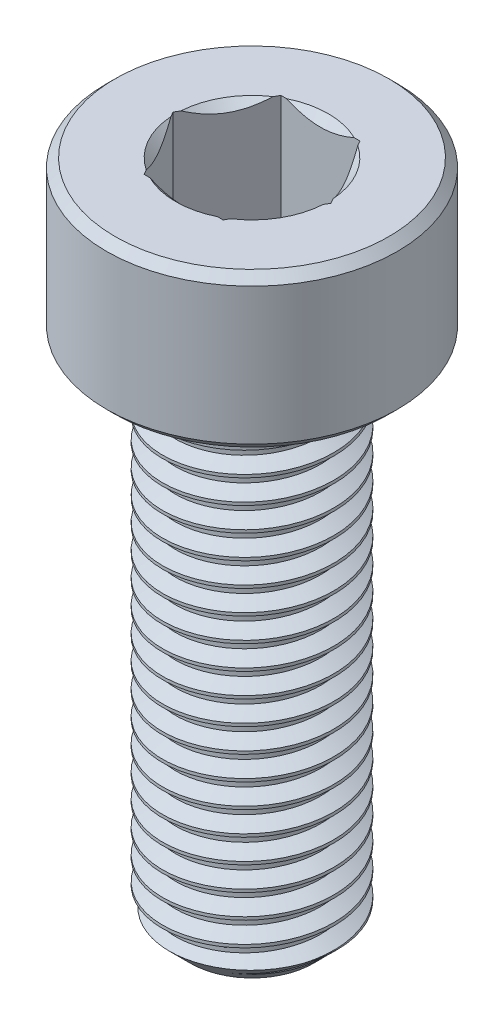
from build123d import *

# Parameters (mm, degrees)
SKETCH1_R           = 2.5
BOSS_EXTRUDE2_DEPTH = 15
CHAMFER1_SIZE       = 0.7
THREAD2_PITCH       = 0.7
SKETCH11_R          = 4.25
BOSS_EXTRUDE3_DEPTH = 4.5
SKETCH12_R          = 2
CUT_EXTRUDE4_DEPTH  = 3.5
CHAMFER3_SIZE       = 0.23
CHAMFER4_SIZE       = 0.25
CUT_EXTRUDE7_DEPTH  = 3.5


with BuildPart() as part:
    # Sketch1 → Boss-Extrude2 (new body)
    with BuildSketch(Plane(origin=(0, 0, 0), x_dir=(1, 0, 0), z_dir=(0, 1, 0))):
        with Locations(Location((0, 0, 0), (0, 0, 270))):
            Circle(SKETCH1_R)
    extrude(amount=BOSS_EXTRUDE2_DEPTH)

    # Chamfer1
    chamfer1_edges = [part.edges().sort_by_distance(p)[0] for p in [
        (0, 0, -2.5),
    ]]
    chamfer(chamfer1_edges, length=CHAMFER1_SIZE)

    # Thread2: the profile of Thread Profile4 profile screwed along a right-hand helix of 57.142857 turns, 6 arcs to a turn; built about Z, then put on its axis
    thread2_z = Axis((0, 0, 0), (0, 0, 1))
    thread2_corners = [(2.5003, 0, -0.000173205), (2.5003, 0, 0.612673203), (2.121113887, 0, 0.393749999), (2.121113887, 0, 0.218749999)]
    with BuildLine(mode=Mode.PRIVATE) as thread2_profile:
        Line(thread2_corners[0], thread2_corners[1])
        Line(thread2_corners[1], thread2_corners[2])
        Line(thread2_corners[2], thread2_corners[3])
        Line(thread2_corners[3], thread2_corners[0])
    thread2_cap = Face(thread2_profile.wire())
    thread2_turn_angles = [0, 30, 60, 90, 120, 150, 180, 210, 240, 270, 300, 330, 360, 390, 420, 450, 480, 510, 540, 570, 600, 630, 660, 690, 720]
    thread2_turn_weights = [1, 0.8660254037844387, 1, 0.8660254037844387, 1, 0.8660254037844387, 1, 0.8660254037844387, 1, 0.8660254037844387, 1, 0.8660254037844387, 1, 0.8660254037844387, 1, 0.8660254037844387, 1, 0.8660254037844387, 1, 0.8660254037844387, 1, 0.8660254037844387, 1, 0.8660254037844387, 1]
    thread2_turn_rails = [Edge.make_bspline([Vector(p[0], p[1], 0).rotate(thread2_z, thread2_turn_angles[k]) / thread2_turn_weights[k] + Vector(0, 0, p[2] + THREAD2_PITCH * thread2_turn_angles[k] / 360) for k in range(25)], [0, 0, 0, 1, 1, 2, 2, 3, 3, 4, 4, 5, 5, 6, 6, 7, 7, 8, 8, 9, 9, 10, 10, 11, 11, 12, 12, 12], 2, thread2_turn_weights) for p in thread2_corners]
    thread2_turn_sides = [Face.make_surface_from_curves(thread2_turn_rails[p[0]], thread2_turn_rails[p[1]]) for p in [(0, 1), (1, 2), (2, 3), (3, 0)]]
    thread2_last_angles = [20160, 20190, 20220, 20250, 20280, 20310, 20340, 20370, 20400, 20430, 20460, 20490, 20520, 20545.714285714, 20571.428571429]
    thread2_last_weights = [1, 0.8660254037844387, 1, 0.8660254037844387, 1, 0.8660254037844387, 1, 0.8660254037844387, 1, 0.8660254037844387, 1, 0.8660254037844387, 1, 0.9009688679024151, 1]
    thread2_last_rails = [Edge.make_bspline([Vector(p[0], p[1], 0).rotate(thread2_z, thread2_last_angles[k]) / thread2_last_weights[k] + Vector(0, 0, p[2] + THREAD2_PITCH * thread2_last_angles[k] / 360) for k in range(15)], [0, 0, 0, 1, 1, 2, 2, 3, 3, 4, 4, 5, 5, 6, 6, 7, 7, 7], 2, thread2_last_weights) for p in thread2_corners]
    thread2_last_sides = [Face.make_surface_from_curves(thread2_last_rails[p[0]], thread2_last_rails[p[1]]) for p in [(0, 1), (1, 2), (2, 3), (3, 0)]]
    thread2 = Plane(origin=(0, 15, 0), x_dir=(-1, 0, 0), z_dir=(0, -1, 0)) * Solid(Shell([*[p.moved(Location((0, 0, 2 * THREAD2_PITCH * i))) for i in range(28) for p in thread2_turn_sides], *thread2_last_sides, thread2_cap, thread2_cap.rotate(thread2_z, 20571.428571429).moved(Location((0, 0, THREAD2_PITCH * 20571.428571429 / 360)))]))
    add(thread2, mode=Mode.SUBTRACT)

    # Sketch11 → Boss-Extrude3 (add)
    with BuildSketch(Plane(origin=(0, 15, 0), x_dir=(1, 0, 0), z_dir=(0, 1, 0))):
        with Locations(Location((0, 0, 0), (0, 0, 270))):
            Circle(SKETCH11_R)
    extrude(amount=BOSS_EXTRUDE3_DEPTH)

    # Sketch12 → Cut-Extrude4 (cut)
    with BuildSketch(Plane(origin=(0, 19.5, 0), x_dir=(1, 0, 0), z_dir=(0, 1, 0))):
        with Locations(Location((0, 0, 0), (0, 0, 270))):
            Circle(SKETCH12_R)
    extrude(amount=-CUT_EXTRUDE4_DEPTH, mode=Mode.SUBTRACT)

    # Chamfer3
    chamfer3_edges = [part.edges().sort_by_distance(p)[0] for p in [
        (0, 19.5, -2),
    ]]
    chamfer(chamfer3_edges, length=CHAMFER3_SIZE)

    # Chamfer4
    chamfer4_edges = [part.edges().sort_by_distance(p)[0] for p in [
        (0, 15, -4.25),
        (0, 19.5, -4.25),
    ]]
    chamfer(chamfer4_edges, length=CHAMFER4_SIZE)

    # Sketch15 → Cut-Extrude7 (cut)
    with BuildSketch(Plane(origin=(0, 19.5, 0), x_dir=(1, 0, 0), z_dir=(0, 1, 0))):
        Polygon((2.309401077, 0), (1.154700538, 2), (-1.154700538, 2), (-2.309401077, 0), (-1.154700538, -2), (1.154700538, -2), align=None)
    extrude(amount=-CUT_EXTRUDE7_DEPTH, mode=Mode.SUBTRACT)


solid = part.part
